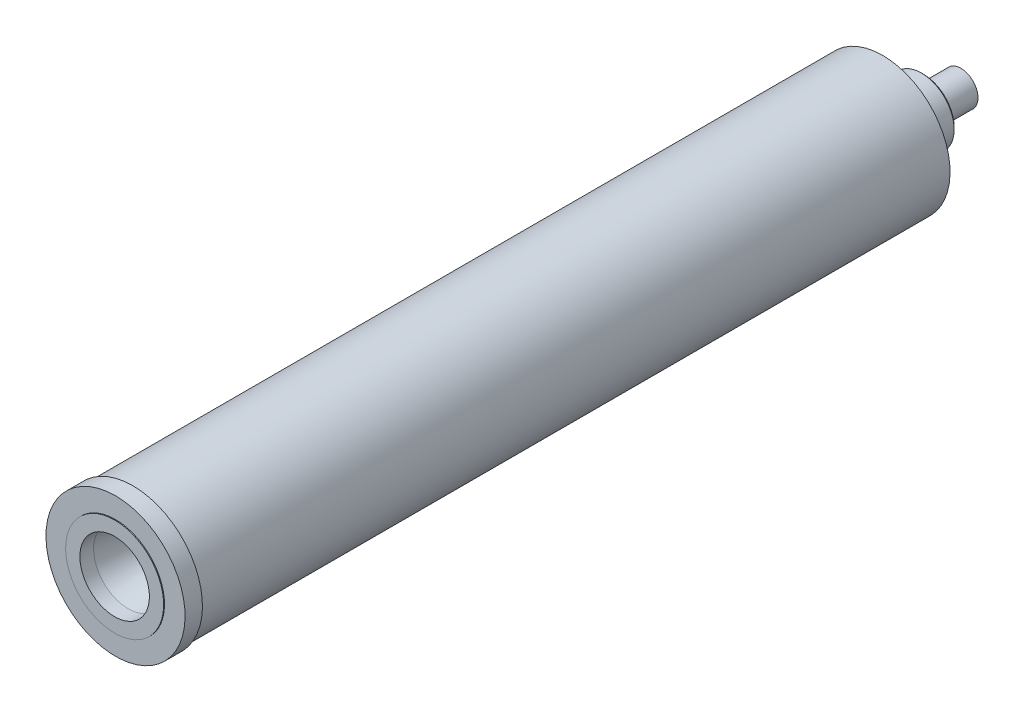
from build123d import *

# Parameters (mm, degrees)
CHAMFER1_SIZE                     = 1.5
F_3_8_16_TAPPED_HOLE1_D           = 7.9375
F_3_8_16_TAPPED_HOLE1_DEPTH       = 25.4
F_3_8_16_TAPPED_HOLE1_CSINK_D     = 10.795
F_3_8_16_TAPPED_HOLE1_CSINK_ANGLE = 100
F_3_8_16_TAPPED_HOLE1_TIP         = 2.384665582


with BuildPart() as part:
    # Sketch1 → Revolve1 (revolve)
    with BuildSketch(Plane(origin=(0, 0, 0), x_dir=(0, 0, -1), z_dir=(1, 0, 0))):
        Polygon((-266.556633419, 50.8), (-253.856633419, 50.8), (-253.856633419, 49.2125), (293.878, 49.2125), (293.878, 23.876), (323.723, 23.876), (323.723, 12.5), (351.028, 12.5), (351.028, 0), (271.028, 0), (271.028, 29.25), (-147.191633419, 29.25), (-147.191633419, 40.25), (-155.185451047, 40.25), (-182.191633419, 13.243817629), (-197.191633419, 14.820381157), (-257.191633419, 25.4), (-267.191633419, 25.4), (-267.191633419, 35.8), (-266.556633419, 35.8), align=None)
    revolve(axis=Axis((0, 0, -473.12001368), (0, 0, 1)))

    # Chamfer1
    chamfer1_edges = [part.edges().sort_by_distance(p)[0] for p in [
        (0, -23.876, -323.723),
    ]]
    chamfer(chamfer1_edges, length=CHAMFER1_SIZE)

    # 3/8-16 Tapped Hole1
    with Locations(Plane(origin=(0, 0, -351.028), x_dir=(-1, 0, 0), z_dir=(0, 0, -1))):
        with Locations((0, 0)):
            CounterSinkHole(F_3_8_16_TAPPED_HOLE1_D / 2, F_3_8_16_TAPPED_HOLE1_CSINK_D / 2, depth=F_3_8_16_TAPPED_HOLE1_DEPTH, counter_sink_angle=F_3_8_16_TAPPED_HOLE1_CSINK_ANGLE)
            with Locations((0, 0, -(F_3_8_16_TAPPED_HOLE1_DEPTH + F_3_8_16_TAPPED_HOLE1_TIP / 2))):  # 118° drill point
                Cone(0, F_3_8_16_TAPPED_HOLE1_D / 2, F_3_8_16_TAPPED_HOLE1_TIP, mode=Mode.SUBTRACT)


solid = part.part
